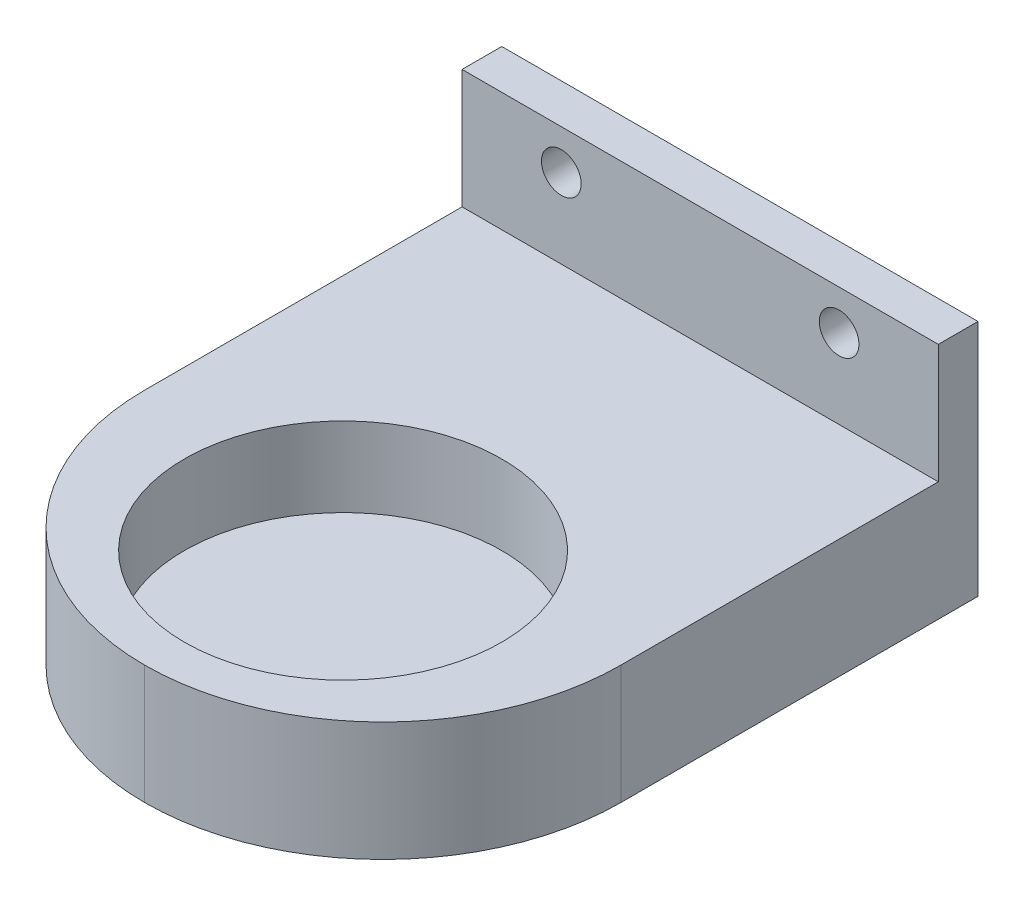
from build123d import *

# Parameters (mm, degrees)
SKETCH1_W           = 60
SKETCH1_H           = 30
BOSS_EXTRUDE1_DEPTH = 5
SKETCH2_W           = 60
SKETCH2_H           = 15
BOSS_EXTRUDE2_DEPTH = 70
SKETCH3_R           = 20
CUT_EXTRUDE1_DEPTH  = 10
SKETCH4_R           = 2.5
CUT_EXTRUDE2_DEPTH  = 5
FILLET1_R           = 30


with BuildPart() as part:
    # Sketch1 → Boss-Extrude1 (new body)
    with BuildSketch(Plane.XY):
        Rectangle(SKETCH1_W, SKETCH1_H)
    extrude(amount=BOSS_EXTRUDE1_DEPTH)

    # Sketch2 → Boss-Extrude2 (add)
    with BuildSketch(Plane.XY.offset(5)):
        with Locations((0, -7.5)):
            Rectangle(SKETCH2_W, SKETCH2_H)
    extrude(amount=BOSS_EXTRUDE2_DEPTH)

    # Sketch3 → Cut-Extrude1 (cut)
    with BuildSketch(Plane(origin=(0, 0, 0), x_dir=(1, 0, 0), z_dir=(0, 1, 0))):
        with Locations(Location((0, -50, 0), (0, 0, 270))):
            Circle(SKETCH3_R)
    extrude(amount=-CUT_EXTRUDE1_DEPTH, mode=Mode.SUBTRACT)

    # Sketch4 → Cut-Extrude2 (cut)
    with BuildSketch(Plane(origin=(0, 0, 0), x_dir=(-1, 0, 0), z_dir=(0, 0, -1))):
        with Locations((-17.5, 10)):
            Circle(SKETCH4_R)
        with Locations((17.5, 10)):
            Circle(SKETCH4_R)
        with Locations((17.5, -5)):
            Circle(SKETCH4_R)
        with Locations((-17.5, -5)):
            Circle(SKETCH4_R)
    extrude(amount=-CUT_EXTRUDE2_DEPTH, mode=Mode.SUBTRACT)

    # Fillet1
    fillet1_edges = [part.edges().sort_by_distance(p)[0] for p in [
        (30, -7.5, 75),
        (-30, -7.5, 75),
    ]]
    fillet(fillet1_edges, radius=FILLET1_R - 0.0001)  # a hair under: the kernel refuses the full size


solid = part.part
